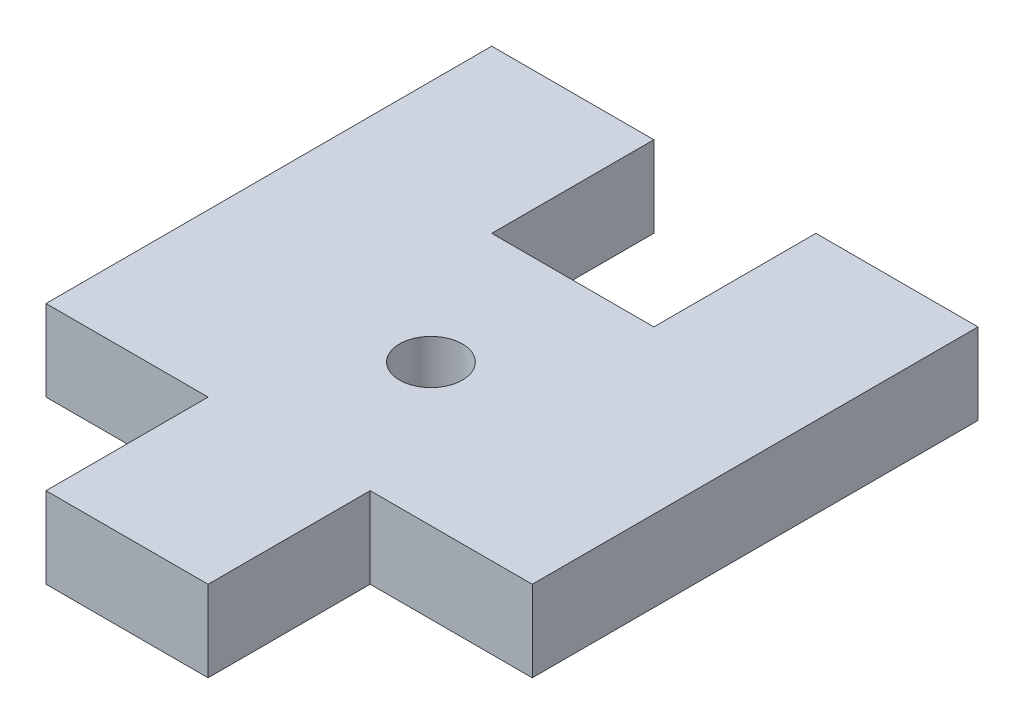
from build123d import *

# Parameters (mm, degrees)
SKETCH_1_W              = 24
SKETCH_1_H              = 30
EXTRUDE_1_DEPTH         = 4
SKETCH_4_W              = 8
SKETCH_4_H              = 8
CUT_EXTRUDE_3_DEPTH     = 20.62141687
HOLE_WIZARD_3_1_3_1_1_D = 3.1


with BuildPart() as part:
    # 草圖1 → 填料-伸長1 (new body)
    with BuildSketch(Plane(origin=(0, 0, 0), x_dir=(1, 0, 0), z_dir=(0, 1, 0))):
        Rectangle(SKETCH_1_W, SKETCH_1_H)
    extrude(amount=EXTRUDE_1_DEPTH)

    # 草圖4 → 除料-伸長3 (cut, through all)
    with BuildSketch(Plane(origin=(0, 4, 0), x_dir=(1, 0, 0), z_dir=(0, 1, 0))):
        with Locations((0, 11)):
            Rectangle(SKETCH_4_W, SKETCH_4_H)
        with Locations((-8, -11)):
            Rectangle(SKETCH_4_W, SKETCH_4_H)
        with Locations((8, -11)):
            Rectangle(SKETCH_4_W, SKETCH_4_H)
    extrude(amount=-CUT_EXTRUDE_3_DEPTH, mode=Mode.SUBTRACT)

    # Ø3.1 (3.1) 直徑孔1 (through all)
    with Locations(Plane.ZX.offset(4)):
        with Locations((0, 0)):
            Hole(HOLE_WIZARD_3_1_3_1_1_D / 2)


solid = part.part
